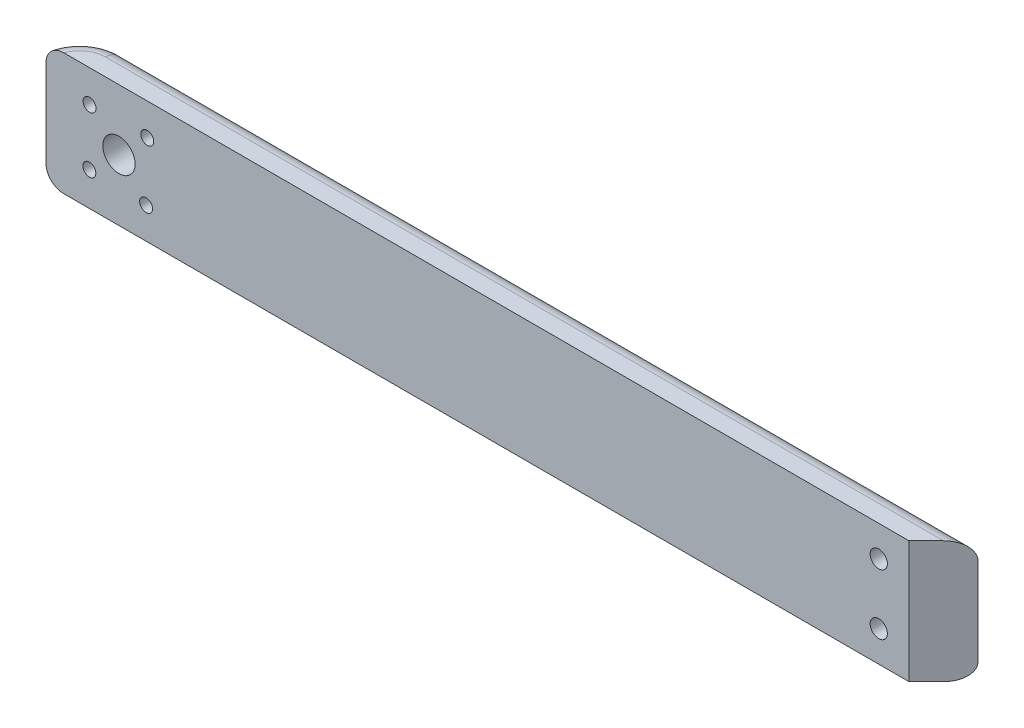
from build123d import *

# Parameters (mm, degrees)
ESQUISSE1_W             = 220
ESQUISSE1_H             = 28.284
BOSS_EXTRU_3_DEPTH      = 8
CHANFREIN1_SIZE         = 20
ESQUISSE4_R             = 2
ENL_V_MAT_EXTRU_1_DEPTH = 8
FILLET1_R               = 10
SKETCH2_R               = 1.5
SKETCH2_R_2             = 3.75
CUT_EXTRUDE1_DEPTH      = 8
FILLET4_R               = 4
FILLET5_R               = 4


with BuildPart() as part:
    # Esquisse1 → Boss.-Extru.3 (new body)
    with BuildSketch(Plane.XY):
        with Locations((110, 14.142)):
            Rectangle(ESQUISSE1_W, ESQUISSE1_H)
    extrude(amount=BOSS_EXTRU_3_DEPTH)

    # Chanfrein1
    # the kernel refuses this chamfer: 20 mm, written as the material it takes off along each edge
    with BuildSketch(Plane(origin=(220, -51.433659759, 8), x_dir=(0.027495876610586317, 0, -0.9996219169112968), z_dir=(0, 1, 0))) as chanfrein1_piece_1:
        Polygon((CHANFREIN1_SIZE * 0.999621916911, CHANFREIN1_SIZE * 0.0274958766106), (-CHANFREIN1_SIZE * 0.0274958766106, CHANFREIN1_SIZE * 0.999621916911), (0, 0), align=None)
    extrude(amount=131.151319519, mode=Mode.SUBTRACT)

    # Esquisse4 → Enlèv. mat.-Extru.1 (cut)
    with BuildSketch(Plane.XY.offset(8)):
        with Locations((193, 7.142)):
            Circle(ESQUISSE4_R)
        with Locations((193, 21.142)):
            Circle(ESQUISSE4_R)
    extrude(amount=-ENL_V_MAT_EXTRU_1_DEPTH, mode=Mode.SUBTRACT)

    # Fillet1
    # the kernel refuses this fillet: 10 mm, written as the material it takes off along each edge
    with BuildSketch(Plane(origin=(0, 52.778897428, 0), x_dir=(1, 0, 0), z_dir=(0, -1, 0))) as fillet1_piece_1:
        with BuildLine():
            CenterArc((9.797958971, 10), FILLET1_R, 191.536959033, 78.463040967)
            Line((0, 8), (-0.195959179, 7.96))
            ThreePointArc((-0.195959179, 7.96), (-0.2, 4), (-0.2, 0))
            Line((-0.2, 0), (0, -0.2))
            Line((0, -0.2), (9.797958971, -0.2))
            Line((9.797958971, -0.2), (9.797958971, 0))
        make_face()
    extrude(amount=77.273794856, mode=Mode.SUBTRACT)

    # Sketch2 → Cut-Extrude1 (cut)
    with BuildSketch(Plane.XY.offset(8)):
        with Locations((10.039316358, 7.799790773)):
            Circle(SKETCH2_R)
        with Locations((10.095797266, 20.845111475)):
            Circle(SKETCH2_R)
        with Locations((23.204777475, 7.243195633)):
            Circle(SKETCH2_R)
        with Locations((23.460536656, 20.883346587)):
            Circle(SKETCH2_R)
        with Locations((16.903459812, 14.177912334)):
            Circle(SKETCH2_R_2)
    extrude(amount=-CUT_EXTRUDE1_DEPTH, mode=Mode.SUBTRACT)

    # Fillet4
    fillet4_edges = [part.edges().sort_by_distance(p)[0] for p in [
        (108.898979486, 0, 0),
        (3.473403651, 0, 2.254033308),
    ]]
    fillet(fillet4_edges, radius=FILLET4_R)

    # Fillet5
    fillet5_edges = [part.edges().sort_by_distance(p)[0] for p in [
        (108.898979486, 28.284, 0),
        (3.473403651, 28.284, 2.254033308),
    ]]
    fillet(fillet5_edges, radius=FILLET5_R)


solid = part.part
